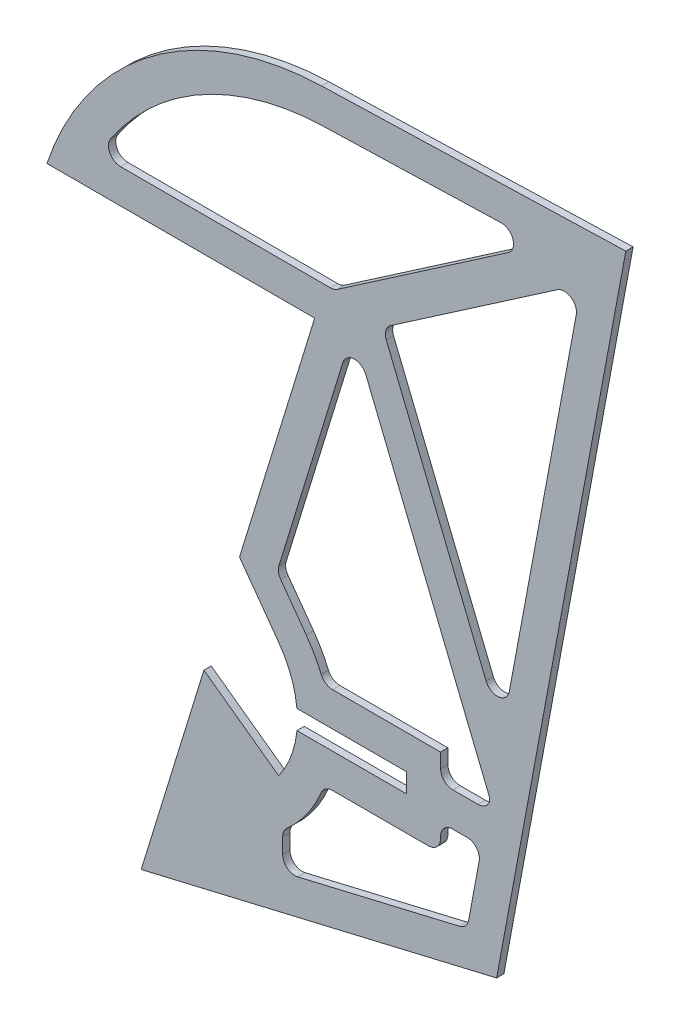
from build123d import *

# Parameters (mm, degrees)
BOSS_EXTRUDE2_DEPTH = 0.762
CUT_EXTRUDE1_DEPTH  = 2.54
FILLET1_R           = 1.27
FILLET2_R           = 1.27


with BuildPart() as part:
    # Sketch1 → Boss-Extrude2 (new body)
    with BuildSketch(Plane.XY):
        with BuildLine():
            Line((-17.038837989, 37.195), (-24.885307058, 11.67932501))
            Line((-24.885307058, 11.67932501), (-20.799118841, 6.0325))
            ThreePointArc((-20.799118841, 6.0325), (-19.511844062, 3.642975475), (-18.894118841, 1))
            Line((-18.894118841, 1), (-7.464118841, 1))
            Line((-7.464118841, 1), (-7.464118841, -1))
            Line((-7.464118841, -1), (-18.894118841, -1))
            ThreePointArc((-18.894118841, -1), (-19.511844062, -3.642975475), (-20.799118841, -6.0325))
            Line((-20.799118841, -6.0325), (-28.596784868, -0.38990775))
            Line((-28.596784868, -0.38990775), (-35.143553898, -21.67913088))
            Line((-35.143553898, -21.67913088), (1.940239682, -12.938292607))
            Line((1.940239682, -12.938292607), (15.418184296, 59.478146197))
            Line((15.418184296, 59.478146197), (-16.317685222, 58.531))
            ThreePointArc((-16.317685222, 58.531), (-34.007299879, 52.375275454), (-44.978837989, 37.195))
            Line((-44.978837989, 37.195), (-17.038837989, 37.195))
        make_face()
    extrude(amount=-BOSS_EXTRUDE2_DEPTH)

    # Sketch2 → Cut-Extrude1 (cut)
    with BuildSketch(Plane(origin=(0, 0, -0.762), x_dir=(-1, 0, 0), z_dir=(0, 0, -1))):
        Polygon((9.959013349, 39.898911244), (-10.811031118, 54.15844292), (-2.469426207, 9.339344835), align=None)
        with BuildLine():
            Line((16.211604848, 54.976582614), (-6.716661044, 55.660868886))
            Line((-6.716661044, 55.660868886), (15.000646844, 40.751))
            Line((15.000646844, 40.751), (39.552648945, 40.751))
            ThreePointArc((39.552648945, 40.751), (29.764823586, 50.952881409), (16.211604848, 54.976582614))
        make_face()
        with BuildLine():
            Line((13.163553789, 37.698855968), (12.959946202, 37.838641361))
            Line((12.959946202, 37.838641361), (-1.264200274, 2.863715758))
            Line((-1.264200274, 2.863715758), (-1.0621299, 1.778))
            Line((-1.0621299, 1.778), (3.908118841, 1.778))
            Line((3.908118841, 1.778), (3.908118841, 4.556))
            Line((3.908118841, 4.556), (16.060442021, 4.556))
            ThreePointArc((16.060442021, 4.556), (16.85953464, 6.404305379), (17.918263947, 8.117160903))
            Line((17.918263947, 8.117160903), (20.965443108, 12.328148402))
            Line((20.965443108, 12.328148402), (13.163553789, 37.698855968))
        make_face()
        with BuildLine():
            Line((3.908118841, -1.778), (-0.400297147, -1.778))
            Line((-0.400297147, -1.778), (1.131614758, -10.008899288))
            Line((1.131614758, -10.008899288), (20.37916729, -14.545645063))
            Line((20.37916729, -14.545645063), (20.37916729, -10.725757063))
            ThreePointArc((20.37916729, -10.725757063), (17.792273547, -7.940143054), (16.060442021, -4.556))
            Line((16.060442021, -4.556), (3.908118841, -4.556))
            Line((3.908118841, -4.556), (3.908118841, -1.778))
        make_face()
    extrude(amount=-CUT_EXTRUDE1_DEPTH, mode=Mode.SUBTRACT)

    # Fillet1
    # the kernel refuses this fillet: 1.27 mm, written as the material it adds along each edge
    with BuildSketch(Plane(origin=(-39.552648945, 40.751, -0.762), x_dir=(0.5208478104072599, 0.8536495524475856, 0), z_dir=(0, 0, 1))) as fillet1_piece_1:
        with BuildLine():
            CenterArc((2.261930285, -1.268884618), FILLET1_R, 87.598517958, 123.790620182)
            Line((1.177795353, -1.930361337), (0, 0))
            ThreePointArc((0, 0), (1.157572593, 0.024262667), (2.315145186, 0))
        make_face()
    extrude(amount=0.762)
    with BuildSketch(Plane(origin=(-15.000646844, 40.751, -0.762), x_dir=(-1, 0, 0), z_dir=(0, 0, 1))) as fillet1_piece_2:
        with BuildLine():
            CenterArc((FILLET1_R * 0.310233467687, -FILLET1_R), FILLET1_R, 90, 34.471278604)
            Line((-FILLET1_R * 0.2557595777, -FILLET1_R * 0.175589985157), (0, 0))
            Line((0, 0), (FILLET1_R * 0.310233467687, 0))
        make_face()
    extrude(amount=0.762)
    with BuildSketch(Plane(origin=(6.716661044, 55.660868886, -0.762), x_dir=(-0.9995549454578584, -0.029831376279645935, 0), z_dir=(0, 0, 1))) as fillet1_piece_3:
        with BuildLine():
            CenterArc((FILLET1_R * 3.40189361791, FILLET1_R), FILLET1_R, 122.761813037, 147.238186963)
            Line((FILLET1_R * 2.86074575566, FILLET1_R * 1.84092745893), (0, 0))
            Line((0, 0), (FILLET1_R * 3.40189361791, 0))
        make_face()
    extrude(amount=0.762)
    with BuildSketch(Plane(origin=(-16.060442021, -4.556, -0.762), x_dir=(1, 0, 0), z_dir=(0, 0, 1))) as fillet1_piece_4:
        with BuildLine():
            CenterArc((0.873205275, -1.27), FILLET1_R, 90, 67.330529822)
            ThreePointArc((-0.298679081, -0.780523691), (-0.143449411, -0.392515792), (0, 0))
            Line((0, 0), (0.873205275, 0))
        make_face()
    extrude(amount=0.762)
    with BuildSketch(Plane(origin=(-20.37916729, -10.725757063, -0.762), x_dir=(0.7616549867095258, 0.6479827784906881, 0), z_dir=(0, 0, 1))) as fillet1_piece_5:
        with BuildLine():
            CenterArc((0.587183206, -1.269738966), FILLET1_R, 91.161693546, 48.448622341)
            Line((-0.380118627, -0.446800838), (0, 0))
            ThreePointArc((0, 0), (0.28071762, -0.002845925), (0.561435241, 0))
        make_face()
    extrude(amount=0.762)
    with BuildSketch(Plane(origin=(-20.37916729, -14.545645063, -0.762), x_dir=(0, 1, 0), z_dir=(0, 0, 1))) as fillet1_piece_6:
        with BuildLine():
            CenterArc((FILLET1_R * 1.26310805209, -FILLET1_R), FILLET1_R, 90, 103.262828677)
            Line((FILLET1_R * 0.289780136608, -FILLET1_R * 1.22941832738), (0, 0))
            Line((0, 0), (FILLET1_R * 1.26310805209, 0))
        make_face()
    extrude(amount=0.762)
    with BuildSketch(Plane(origin=(-1.131614758, -10.008899288, -0.762), x_dir=(-0.9733279154855742, -0.22941832737710197, 0), z_dir=(0, 0, 1))) as fillet1_piece_7:
        with BuildLine():
            CenterArc((FILLET1_R * 0.651818100075, -FILLET1_R), FILLET1_R, 90, 66.194073158)
            Line((-FILLET1_R * 0.263099818984, -FILLET1_R * 0.596360059726), (0, 0))
            Line((0, 0), (FILLET1_R * 0.651818100075, 0))
        make_face()
    extrude(amount=0.762)
    with BuildSketch(Plane(origin=(0.400297147, -1.778, -0.762), x_dir=(-1, 0, 0), z_dir=(0, 0, 1))) as fillet1_piece_8:
        with BuildLine():
            CenterArc((FILLET1_R * 1.20328955763, FILLET1_R), FILLET1_R, 169.456901836, 100.543098164)
            Line((FILLET1_R * 0.220172006676, FILLET1_R * 1.182975083), (0, 0))
            Line((0, 0), (FILLET1_R * 1.20328955763, 0))
        make_face()
    extrude(amount=0.762)
    with BuildSketch(Plane(origin=(-3.908118841, -1.778, -0.762), x_dir=(1, 0, 0), z_dir=(0, 0, 1)), Plane(origin=(-3.908118841, 1.778, -0.762), x_dir=(0, 1, 0), z_dir=(0, 0, 1))) as fillet1_piece_9:
        with BuildLine():
            CenterArc((FILLET1_R, -FILLET1_R), FILLET1_R, 90, 90)
            Line((0, -FILLET1_R), (0, 0))
            Line((0, 0), (FILLET1_R, 0))
        make_face()
    extrude(amount=0.762)
    with BuildSketch(Plane(origin=(10.811031118, 54.15844292, -0.762), x_dir=(-0.8244100148431994, -0.5659930453868101, 0), z_dir=(0, 0, 1))) as fillet1_piece_10:
        with BuildLine():
            CenterArc((FILLET1_R * 2.41507052303, FILLET1_R), FILLET1_R, 134.985623232, 135.014376768)
            Line((FILLET1_R * 1.7081411927, FILLET1_R * 1.70728418753), (0, 0))
            Line((0, 0), (FILLET1_R * 2.41507052303, 0))
        make_face()
    extrude(amount=0.762)
    with BuildSketch(Plane(origin=(-9.959013349, 39.898911244, -0.762), x_dir=(0.824410014843199, 0.5659930453868107, 0), z_dir=(0, 0, 1))) as fillet1_piece_11:
        with BuildLine():
            CenterArc((FILLET1_R * 0.804884205906, -FILLET1_R), FILLET1_R, 90, 77.660077981)
            Line((-FILLET1_R * 0.172012698042, -FILLET1_R * 0.786288888787), (0, 0))
            Line((0, 0), (FILLET1_R * 0.804884205906, 0))
        make_face()
    extrude(amount=0.762)
    with BuildSketch(Plane(origin=(2.469426207, 9.339344835, -0.762), x_dir=(-0.37673127332714895, 0.9263225937530105, 0), z_dir=(0, 0, 1))) as fillet1_piece_12:
        with BuildLine():
            CenterArc((FILLET1_R * 3.41150341271, -FILLET1_R), FILLET1_R, 90, 147.325545251)
            Line((FILLET1_R * 2.87163833244, -FILLET1_R * 1.84175156376), (0, 0))
            Line((0, 0), (FILLET1_R * 3.41150341271, 0))
        make_face()
    extrude(amount=0.762)
    with BuildSketch(Plane(origin=(-16.060442021, 4.556, -0.762), x_dir=(-0.35739171022603367, 0.9339545842607717, 0), z_dir=(0, 0, 1))) as fillet1_piece_13:
        with BuildLine():
            CenterArc((0.874045995, -1.269421541), FILLET1_R, 91.729372014, 67.330529822)
            Line((-0.312076327, -0.815534069), (0, 0))
            ThreePointArc((0, 0), (0.417859553, -0.006306655), (0.835719106, 0))
        make_face()
    extrude(amount=0.762)
    with BuildSketch(Plane(origin=(1.0621299, 1.778, -0.762), x_dir=(-1, 0, 0), z_dir=(0, 0, 1))) as fillet1_piece_14:
        with BuildLine():
            CenterArc((FILLET1_R * 0.831055163452, -FILLET1_R), FILLET1_R, 90, 79.456901836)
            Line((-FILLET1_R * 0.152062387507, -FILLET1_R * 0.817024917004), (0, 0))
            Line((0, 0), (FILLET1_R * 0.831055163452, 0))
        make_face()
    extrude(amount=0.762)
    with BuildSketch(Plane(origin=(1.264200274, 2.863715758, -0.762), x_dir=(-0.18297508299575613, -0.9831175509585292, 0), z_dir=(0, 0, 1))) as fillet1_piece_15:
        with BuildLine():
            CenterArc((FILLET1_R * 0.293125897595, -FILLET1_R), FILLET1_R, 90, 32.674454749)
            Line((-FILLET1_R * 0.24673918268, -FILLET1_R * 0.158248436236), (0, 0))
            Line((0, 0), (FILLET1_R * 0.293125897595, 0))
        make_face()
    extrude(amount=0.762)
    with BuildSketch(Plane(origin=(-13.163553789, 37.698855968, -0.762), x_dir=(0.8244100148432169, 0.5659930453867846, 0), z_dir=(0, 0, 1))) as fillet1_piece_16:
        with BuildLine():
            CenterArc((0.466869862, -1.250818003), FILLET1_R, 99.970819011, 28.464420859)
            Line((-0.322599825, -0.256012688), (0, 0))
            Line((0, 0), (0.246973695, 0))
        make_face()
    extrude(amount=0.762)
    with BuildSketch(Plane(origin=(-20.965443108, 12.328148402, -0.762), x_dir=(0.29393158388003876, 0.9558264612353917, 0), z_dir=(0, 0, 1))) as fillet1_piece_17:
        with BuildLine():
            CenterArc((FILLET1_R * 0.49840674513, -FILLET1_R), FILLET1_R, 90, 52.983950443)
            Line((-FILLET1_R * 0.300060154598, -FILLET1_R * 0.397961288587), (0, 0))
            Line((0, 0), (FILLET1_R * 0.49840674513, 0))
        make_face()
    extrude(amount=0.762)
    # the kernel refuses this fillet: 1.27 mm, written as the material it takes off along each edge
    with BuildSketch(Plane(origin=(-3.908118841, -4.556, -3.937), x_dir=(0, 1, 0), z_dir=(0, 0, 1))) as fillet1_2_piece_1:
        with BuildLine():
            CenterArc((FILLET1_R, FILLET1_R), FILLET1_R, 180, 90)
            Line((0, FILLET1_R), (0, 0))
            Line((0, 0), (FILLET1_R, 0))
        make_face()
    extrude(amount=7.112, mode=Mode.SUBTRACT)

    # Fillet2
    # the kernel refuses this fillet: 1.27 mm, written as the material it adds along each edge
    with BuildSketch(Plane(origin=(-12.959946202, 37.838641361, -0.762), x_dir=(-0.33704949641536375, -0.9414869287282484, 0), z_dir=(0, 0, 1))) as fillet2_piece_1:
        with BuildLine():
            CenterArc((3.321849705, 1.268688867), FILLET2_R, 131.828571636, 140.775161889)
            Line((2.474881455, 2.215021147), (2.390184631, 2.309654375))
            Line((2.390184631, 2.309654375), (-0.084696825, 0.094633228))
            Line((-0.084696825, 0.094633228), (-0.055395427, -0.114281874))
            ThreePointArc((-0.055395427, -0.114281874), (0.617417306, -0.252739018), (3.385312737, -0.126868887))
            Line((3.385312737, -0.126868887), (3.37954337, 0))
        make_face()
    extrude(amount=0.762)


solid = part.part
